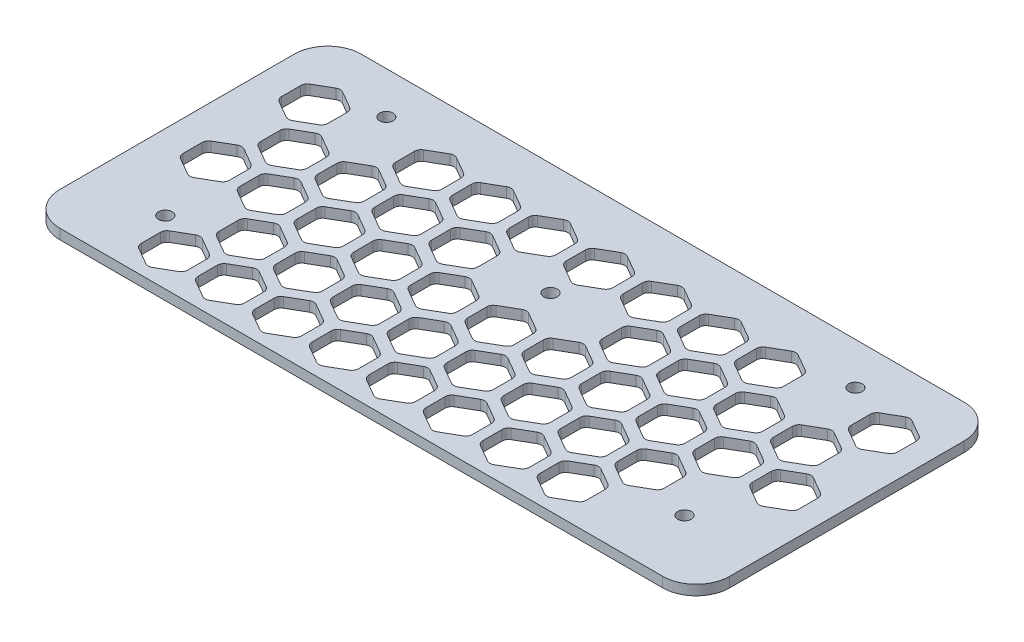
from build123d import *

# Parameters (mm, degrees)
SKETCH_1_W          = 200
SKETCH_1_H          = 90
EXTRUDE_1_DEPTH     = 3
SKETCH_2_R          = 2.025
CUT_EXTRUDE_1_DEPTH = 110.69958979
FILLET_1_R          = 10
FILLET_2_R          = 10
SKETCH_3_R          = 2.025
CUT_EXTRUDE_2_DEPTH = 110.69958979
CUT_EXTRUDE_3_DEPTH = 110.69958979
OTHER_1_DEPTH       = 3
FILLET_3_R          = 2


# Read off the part's stored shape, not the designer's step: 填充阵列1
with BuildPart() as part:
    # 草图1 → 凸台-拉伸1 (new body)
    with BuildSketch(Plane(origin=(0, 0, 0), x_dir=(1, 0, 0), z_dir=(0, 1, 0))):
        Rectangle(SKETCH_1_W, SKETCH_1_H)
    extrude(amount=EXTRUDE_1_DEPTH)

    # 草图2 → 切除-拉伸1 (cut, through all)
    with BuildSketch(Plane(origin=(0, 3, 0), x_dir=(1, 0, 0), z_dir=(0, 1, 0))):
        with Locations(Location((-70, 32.5, 0), (0, 0, 270))):
            Circle(SKETCH_2_R)
        with Locations(Location((70, 32.5, 0), (0, 0, 270))):
            Circle(SKETCH_2_R)
        with Locations(Location((-77.5, -26, 0), (0, 0, 270))):
            Circle(SKETCH_2_R)
        with Locations(Location((77.5, -26, 0), (0, 0, 270))):
            Circle(SKETCH_2_R)
    extrude(amount=-CUT_EXTRUDE_1_DEPTH, mode=Mode.SUBTRACT)

    # 圆角1
    fillet_1_edges = [part.edges().sort_by_distance(p)[0] for p in [
        (-100, 1.5, -45),
        (100, 1.5, -45),
    ]]
    fillet(fillet_1_edges, radius=FILLET_1_R)

    # 圆角2
    fillet_2_edges = [part.edges().sort_by_distance(p)[0] for p in [
        (100, 1.5, 45),
        (-100, 1.5, 45),
    ]]
    fillet(fillet_2_edges, radius=FILLET_2_R)

    # 草图3 → 切除-拉伸2 (cut, through all)
    with BuildSketch(Plane.XZ):
        with Locations(Location((0, -11.5, 0), (0, 0, 270))):
            Circle(SKETCH_3_R)
    extrude(amount=-CUT_EXTRUDE_2_DEPTH, mode=Mode.SUBTRACT)

    # 草图4 → 切除-拉伸3 (cut, through all)
    with BuildSketch(Plane(origin=(0, 3, 0), x_dir=(1, 0, 0), z_dir=(0, 1, 0))):
        Polygon((-84, 17), (-77.07179677, 21), (-77.07179677, 29), (-84, 33), (-90.92820323, 29), (-90.92820323, 21), align=None)
    extrude(amount=-CUT_EXTRUDE_3_DEPTH, mode=Mode.SUBTRACT)

    # 填充阵列1 outline → 填充阵列1 (cut)
    with BuildSketch(Plane(origin=(0, 0, 0), x_dir=(1, 0, 0), z_dir=(0, 1, 0))):
        Polygon((-65.42820323, 14.277568136), (-65.42820323, 6.277568136), (-58.5, 2.277568136), (-51.57179677, 6.277568136), (-51.57179677, 14.277568136), (-58.5, 18.277568136), align=None)
        Polygon((11.07179677, -29.889727457), (11.07179677, -37.889727457), (18, -41.889727457), (24.92820323, -37.889727457), (24.92820323, -29.889727457), (18, -25.889727457), align=None)
        Polygon((-39.92820323, -0.444863729), (-39.92820323, -8.444863729), (-33, -12.444863729), (-26.07179677, -8.444863729), (-26.07179677, -0.444863729), (-33, 3.555136271), align=None)
        Polygon((-14.42820323, -15.167295593), (-14.42820323, -23.167295593), (-7.5, -27.167295593), (-0.57179677, -23.167295593), (-0.57179677, -15.167295593), (-7.5, -11.167295593), align=None)
        Polygon((-84, 3.555136271), (-90.92820323, -0.444863729), (-90.92820323, -8.444863729), (-84, -12.444863729), (-77.07179677, -8.444863729), (-77.07179677, -0.444863729), align=None)
        Polygon((79.07179677, -0.444863729), (79.07179677, -8.444863729), (86, -12.444863729), (92.92820323, -8.444863729), (92.92820323, -0.444863729), (86, 3.555136271), align=None)
        Polygon((28.07179677, 29), (28.07179677, 21), (35, 17), (41.92820323, 21), (41.92820323, 29), (35, 33), align=None)
        Polygon((53.57179677, 14.277568136), (53.57179677, 6.277568136), (60.5, 2.277568136), (67.42820323, 6.277568136), (67.42820323, 14.277568136), (60.5, 18.277568136), align=None)
        Polygon((86, 33), (79.07179677, 29), (79.07179677, 21), (86, 17), (92.92820323, 21), (92.92820323, 29), align=None)
        Polygon((41.92820323, -29.889727457), (35, -25.889727457), (28.07179677, -29.889727457), (28.07179677, -37.889727457), (35, -41.889727457), (41.92820323, -37.889727457), align=None)
        Polygon((67.42820323, -15.167295593), (60.5, -11.167295593), (53.57179677, -15.167295593), (53.57179677, -23.167295593), (60.5, -27.167295593), (67.42820323, -23.167295593), align=None)
        Polygon((-73.92820323, -29.889727457), (-73.92820323, -37.889727457), (-67, -41.889727457), (-60.07179677, -37.889727457), (-60.07179677, -29.889727457), (-67, -25.889727457), align=None)
        Polygon((-67, 3.555136271), (-73.92820323, -0.444863729), (-73.92820323, -8.444863729), (-67, -12.444863729), (-60.07179677, -8.444863729), (-60.07179677, -0.444863729), align=None)
        Polygon((-9.07179677, -0.444863729), (-16, 3.555136271), (-22.92820323, -0.444863729), (-22.92820323, -8.444863729), (-16, -12.444863729), (-9.07179677, -8.444863729), align=None)
        Polygon((-34.57179677, -15.167295593), (-41.5, -11.167295593), (-48.42820323, -15.167295593), (-48.42820323, -23.167295593), (-41.5, -27.167295593), (-34.57179677, -23.167295593), align=None)
        Polygon((-56.92820323, 29), (-56.92820323, 21), (-50, 17), (-43.07179677, 21), (-43.07179677, 29), (-50, 33), align=None)
        Polygon((19.57179677, -15.167295593), (19.57179677, -23.167295593), (26.5, -27.167295593), (33.42820323, -23.167295593), (33.42820323, -15.167295593), (26.5, -11.167295593), align=None)
        Polygon((45.07179677, -29.889727457), (45.07179677, -37.889727457), (52, -41.889727457), (58.92820323, -37.889727457), (58.92820323, -29.889727457), (52, -25.889727457), align=None)
        Polygon((-31.42820323, 14.277568136), (-31.42820323, 6.277568136), (-24.5, 2.277568136), (-17.57179677, 6.277568136), (-17.57179677, 14.277568136), (-24.5, 18.277568136), align=None)
        Polygon((-5.92820323, -0.444863729), (-5.92820323, -8.444863729), (1, -12.444863729), (7.92820323, -8.444863729), (7.92820323, -0.444863729), (1, 3.555136271), align=None)
        Polygon((-50, 3.555136271), (-56.92820323, -0.444863729), (-56.92820323, -8.444863729), (-50, -12.444863729), (-43.07179677, -8.444863729), (-43.07179677, -0.444863729), align=None)
        Polygon((-50, -25.889727457), (-56.92820323, -29.889727457), (-56.92820323, -37.889727457), (-50, -41.889727457), (-43.07179677, -37.889727457), (-43.07179677, -29.889727457), align=None)
        Polygon((-68.57179677, 14.277568136), (-75.5, 18.277568136), (-82.42820323, 14.277568136), (-82.42820323, 6.277568136), (-75.5, 2.277568136), (-68.57179677, 6.277568136), align=None)
        Polygon((-22.92820323, -29.889727457), (-22.92820323, -37.889727457), (-16, -41.889727457), (-9.07179677, -37.889727457), (-9.07179677, -29.889727457), (-16, -25.889727457), align=None)
        Polygon((-34.57179677, 14.277568136), (-41.5, 18.277568136), (-48.42820323, 14.277568136), (-48.42820323, 6.277568136), (-41.5, 2.277568136), (-34.57179677, 6.277568136), align=None)
        Polygon((-9.07179677, 29), (-16, 33), (-22.92820323, 29), (-22.92820323, 21), (-16, 17), (-9.07179677, 21), align=None)
        Polygon((-58.5, -11.167295593), (-65.42820323, -15.167295593), (-65.42820323, -23.167295593), (-58.5, -27.167295593), (-51.57179677, -23.167295593), (-51.57179677, -15.167295593), align=None)
        Polygon((-26.07179677, 29), (-33, 33), (-39.92820323, 29), (-39.92820323, 21), (-33, 17), (-26.07179677, 21), align=None)
        Polygon((2.57179677, -15.167295593), (2.57179677, -23.167295593), (9.5, -27.167295593), (16.42820323, -23.167295593), (16.42820323, -15.167295593), (9.5, -11.167295593), align=None)
        Polygon((36.57179677, -15.167295593), (36.57179677, -23.167295593), (43.5, -27.167295593), (50.42820323, -23.167295593), (50.42820323, -15.167295593), (43.5, -11.167295593), align=None)
        Polygon((11.07179677, -0.444863729), (11.07179677, -8.444863729), (18, -12.444863729), (24.92820323, -8.444863729), (24.92820323, -0.444863729), (18, 3.555136271), align=None)
        Polygon((-33, -25.889727457), (-39.92820323, -29.889727457), (-39.92820323, -37.889727457), (-33, -41.889727457), (-26.07179677, -37.889727457), (-26.07179677, -29.889727457), align=None)
        Polygon((24.92820323, 29), (18, 33), (11.07179677, 29), (11.07179677, 21), (18, 17), (24.92820323, 21), align=None)
        Polygon((-31.42820323, -15.167295593), (-31.42820323, -23.167295593), (-24.5, -27.167295593), (-17.57179677, -23.167295593), (-17.57179677, -15.167295593), (-24.5, -11.167295593), align=None)
        Polygon((-5.92820323, -29.889727457), (-5.92820323, -37.889727457), (1, -41.889727457), (7.92820323, -37.889727457), (7.92820323, -29.889727457), (1, -25.889727457), align=None)
        Polygon((7.92820323, 29), (1, 33), (-5.92820323, 29), (-5.92820323, 21), (1, 17), (7.92820323, 21), align=None)
        Polygon((36.57179677, 14.277568136), (36.57179677, 6.277568136), (43.5, 2.277568136), (50.42820323, 6.277568136), (50.42820323, 14.277568136), (43.5, 18.277568136), align=None)
        Polygon((62.07179677, -0.444863729), (62.07179677, -8.444863729), (69, -12.444863729), (75.92820323, -8.444863729), (75.92820323, -0.444863729), (69, 3.555136271), align=None)
        Polygon((28.07179677, -0.444863729), (28.07179677, -8.444863729), (35, -12.444863729), (41.92820323, -8.444863729), (41.92820323, -0.444863729), (35, 3.555136271), align=None)
        Polygon((45.07179677, 29), (45.07179677, 21), (52, 17), (58.92820323, 21), (58.92820323, 29), (52, 33), align=None)
        Polygon((70.57179677, 14.277568136), (70.57179677, 6.277568136), (77.5, 2.277568136), (84.42820323, 6.277568136), (84.42820323, 14.277568136), (77.5, 18.277568136), align=None)
        Polygon((52, 3.555136271), (45.07179677, -0.444863729), (45.07179677, -8.444863729), (52, -12.444863729), (58.92820323, -8.444863729), (58.92820323, -0.444863729), align=None)
        Polygon((33.42820323, 14.277568136), (26.5, 18.277568136), (19.57179677, 14.277568136), (19.57179677, 6.277568136), (26.5, 2.277568136), (33.42820323, 6.277568136), align=None)
    extrude(amount=OTHER_1_DEPTH, mode=Mode.SUBTRACT)

    # 圆角3
    fillet_3_edges = [part.edges().sort_by_distance(p)[0] for p in [
        (-7.5, 1.5, 27.167295593),
        (-14.42820323, 1.5, 23.167295593),
        (-14.42820323, 1.5, 15.167295593),
        (-7.5, 1.5, 11.167295593),
        (-0.57179677, 1.5, 15.167295593),
        (-0.57179677, 1.5, 23.167295593),
        (1, 1.5, 12.444863729),
        (-5.92820323, 1.5, 8.444863729),
        (-5.92820323, 1.5, 0.444863729),
        (1, 1.5, -3.555136271),
        (7.92820323, 1.5, 0.444863729),
        (7.92820323, 1.5, 8.444863729),
        (-16, 1.5, 41.889727457),
        (-22.92820323, 1.5, 37.889727457),
        (-22.92820323, 1.5, 29.889727457),
        (-16, 1.5, 25.889727457),
        (-9.07179677, 1.5, 29.889727457),
        (-9.07179677, 1.5, 37.889727457),
        (1, 1.5, -17),
        (-5.92820323, 1.5, -21),
        (-5.92820323, 1.5, -29),
        (1, 1.5, -33),
        (7.92820323, 1.5, -29),
        (7.92820323, 1.5, -21),
        (9.5, 1.5, 27.167295593),
        (2.57179677, 1.5, 23.167295593),
        (2.57179677, 1.5, 15.167295593),
        (9.5, 1.5, 11.167295593),
        (16.42820323, 1.5, 15.167295593),
        (16.42820323, 1.5, 23.167295593),
        (18, 1.5, 12.444863729),
        (11.07179677, 1.5, 8.444863729),
        (11.07179677, 1.5, 0.444863729),
        (18, 1.5, -3.555136271),
        (24.92820323, 1.5, 0.444863729),
        (24.92820323, 1.5, 8.444863729),
        (1, 1.5, 41.889727457),
        (-5.92820323, 1.5, 37.889727457),
        (-5.92820323, 1.5, 29.889727457),
        (1, 1.5, 25.889727457),
        (7.92820323, 1.5, 29.889727457),
        (7.92820323, 1.5, 37.889727457),
        (18, 1.5, -17),
        (11.07179677, 1.5, -21),
        (11.07179677, 1.5, -29),
        (18, 1.5, -33),
        (24.92820323, 1.5, -29),
        (24.92820323, 1.5, -21),
        (-33, 1.5, 12.444863729),
        (-39.92820323, 1.5, 8.444863729),
        (-39.92820323, 1.5, 0.444863729),
        (-33, 1.5, -3.555136271),
        (-26.07179677, 1.5, 0.444863729),
        (-26.07179677, 1.5, 8.444863729),
        (-24.5, 1.5, -2.277568136),
        (-31.42820323, 1.5, -6.277568136),
        (-31.42820323, 1.5, -14.277568136),
        (-24.5, 1.5, -18.277568136),
        (-17.57179677, 1.5, -14.277568136),
        (-17.57179677, 1.5, -6.277568136),
        (-50, 1.5, 41.889727457),
        (-56.92820323, 1.5, 37.889727457),
        (-56.92820323, 1.5, 29.889727457),
        (-50, 1.5, 25.889727457),
        (-43.07179677, 1.5, 29.889727457),
        (-43.07179677, 1.5, 37.889727457),
        (-41.5, 1.5, 27.167295593),
        (-48.42820323, 1.5, 23.167295593),
        (-48.42820323, 1.5, 15.167295593),
        (-41.5, 1.5, 11.167295593),
        (-34.57179677, 1.5, 15.167295593),
        (-34.57179677, 1.5, 23.167295593),
        (-24.5, 1.5, 27.167295593),
        (-31.42820323, 1.5, 23.167295593),
        (-31.42820323, 1.5, 15.167295593),
        (-24.5, 1.5, 11.167295593),
        (-17.57179677, 1.5, 15.167295593),
        (-17.57179677, 1.5, 23.167295593),
        (-16, 1.5, 12.444863729),
        (-22.92820323, 1.5, 8.444863729),
        (-22.92820323, 1.5, 0.444863729),
        (-16, 1.5, -3.555136271),
        (-9.07179677, 1.5, 0.444863729),
        (-9.07179677, 1.5, 8.444863729),
        (-33, 1.5, 41.889727457),
        (-39.92820323, 1.5, 37.889727457),
        (-39.92820323, 1.5, 29.889727457),
        (-33, 1.5, 25.889727457),
        (-26.07179677, 1.5, 29.889727457),
        (-26.07179677, 1.5, 37.889727457),
        (-16, 1.5, -17),
        (-22.92820323, 1.5, -21),
        (-22.92820323, 1.5, -29),
        (-16, 1.5, -33),
        (-9.07179677, 1.5, -29),
        (-9.07179677, 1.5, -21),
        (52, 1.5, 41.889727457),
        (45.07179677, 1.5, 37.889727457),
        (45.07179677, 1.5, 29.889727457),
        (52, 1.5, 25.889727457),
        (58.92820323, 1.5, 29.889727457),
        (58.92820323, 1.5, 37.889727457),
        (60.5, 1.5, -2.277568136),
        (53.57179677, 1.5, -6.277568136),
        (53.57179677, 1.5, -14.277568136),
        (60.5, 1.5, -18.277568136),
        (67.42820323, 1.5, -14.277568136),
        (67.42820323, 1.5, -6.277568136),
        (43.5, 1.5, 27.167295593),
        (36.57179677, 1.5, 23.167295593),
        (36.57179677, 1.5, 15.167295593),
        (43.5, 1.5, 11.167295593),
        (50.42820323, 1.5, 15.167295593),
        (50.42820323, 1.5, 23.167295593),
        (52, 1.5, 12.444863729),
        (45.07179677, 1.5, 8.444863729),
        (45.07179677, 1.5, 0.444863729),
        (52, 1.5, -3.555136271),
        (58.92820323, 1.5, 0.444863729),
        (58.92820323, 1.5, 8.444863729),
        (77.5, 1.5, -2.277568136),
        (70.57179677, 1.5, -6.277568136),
        (70.57179677, 1.5, -14.277568136),
        (77.5, 1.5, -18.277568136),
        (84.42820323, 1.5, -14.277568136),
        (84.42820323, 1.5, -6.277568136),
        (86, 1.5, -17),
        (79.07179677, 1.5, -21),
        (79.07179677, 1.5, -29),
        (86, 1.5, -33),
        (92.92820323, 1.5, -29),
        (92.92820323, 1.5, -21),
        (60.5, 1.5, 27.167295593),
        (53.57179677, 1.5, 23.167295593),
        (53.57179677, 1.5, 15.167295593),
        (60.5, 1.5, 11.167295593),
        (67.42820323, 1.5, 15.167295593),
        (67.42820323, 1.5, 23.167295593),
        (69, 1.5, 12.444863729),
        (62.07179677, 1.5, 8.444863729),
        (62.07179677, 1.5, 0.444863729),
        (69, 1.5, -3.555136271),
        (75.92820323, 1.5, 0.444863729),
        (75.92820323, 1.5, 8.444863729),
        (35, 1.5, -17),
        (28.07179677, 1.5, -21),
        (28.07179677, 1.5, -29),
        (35, 1.5, -33),
        (41.92820323, 1.5, -29),
        (41.92820323, 1.5, -21),
        (26.5, 1.5, -2.277568136),
        (19.57179677, 1.5, -6.277568136),
        (19.57179677, 1.5, -14.277568136),
        (26.5, 1.5, -18.277568136),
        (33.42820323, 1.5, -14.277568136),
        (33.42820323, 1.5, -6.277568136),
        (26.5, 1.5, 27.167295593),
        (19.57179677, 1.5, 23.167295593),
        (19.57179677, 1.5, 15.167295593),
        (26.5, 1.5, 11.167295593),
        (33.42820323, 1.5, 15.167295593),
        (33.42820323, 1.5, 23.167295593),
        (18, 1.5, 41.889727457),
        (11.07179677, 1.5, 37.889727457),
        (11.07179677, 1.5, 29.889727457),
        (18, 1.5, 25.889727457),
        (24.92820323, 1.5, 29.889727457),
        (24.92820323, 1.5, 37.889727457),
        (35, 1.5, 41.889727457),
        (28.07179677, 1.5, 37.889727457),
        (28.07179677, 1.5, 29.889727457),
        (35, 1.5, 25.889727457),
        (41.92820323, 1.5, 29.889727457),
        (41.92820323, 1.5, 37.889727457),
        (52, 1.5, -17),
        (45.07179677, 1.5, -21),
        (45.07179677, 1.5, -29),
        (52, 1.5, -33),
        (58.92820323, 1.5, -29),
        (58.92820323, 1.5, -21),
        (35, 1.5, 12.444863729),
        (28.07179677, 1.5, 8.444863729),
        (28.07179677, 1.5, 0.444863729),
        (35, 1.5, -3.555136271),
        (41.92820323, 1.5, 0.444863729),
        (41.92820323, 1.5, 8.444863729),
        (43.5, 1.5, -2.277568136),
        (36.57179677, 1.5, -6.277568136),
        (36.57179677, 1.5, -14.277568136),
        (43.5, 1.5, -18.277568136),
        (50.42820323, 1.5, -14.277568136),
        (50.42820323, 1.5, -6.277568136),
        (-75.5, 1.5, -2.277568136),
        (-82.42820323, 1.5, -6.277568136),
        (-82.42820323, 1.5, -14.277568136),
        (-75.5, 1.5, -18.277568136),
        (-68.57179677, 1.5, -14.277568136),
        (-68.57179677, 1.5, -6.277568136),
        (-84, 1.5, 12.444863729),
        (-90.92820323, 1.5, 8.444863729),
        (-90.92820323, 1.5, 0.444863729),
        (-84, 1.5, -3.555136271),
        (-77.07179677, 1.5, 0.444863729),
        (-77.07179677, 1.5, 8.444863729),
        (-50, 1.5, 12.444863729),
        (-56.92820323, 1.5, 8.444863729),
        (-56.92820323, 1.5, 0.444863729),
        (-50, 1.5, -3.555136271),
        (-43.07179677, 1.5, 0.444863729),
        (-43.07179677, 1.5, 8.444863729),
        (-58.5, 1.5, 27.167295593),
        (-65.42820323, 1.5, 23.167295593),
        (-65.42820323, 1.5, 15.167295593),
        (-58.5, 1.5, 11.167295593),
        (-51.57179677, 1.5, 15.167295593),
        (-51.57179677, 1.5, 23.167295593),
        (-33, 1.5, -17),
        (-39.92820323, 1.5, -21),
        (-39.92820323, 1.5, -29),
        (-33, 1.5, -33),
        (-26.07179677, 1.5, -29),
        (-26.07179677, 1.5, -21),
        (-84, 1.5, -17),
        (-41.5, 1.5, -2.277568136),
        (-48.42820323, 1.5, -6.277568136),
        (-90.92820323, 1.5, -21),
        (-48.42820323, 1.5, -14.277568136),
        (-41.5, 1.5, -18.277568136),
        (-34.57179677, 1.5, -14.277568136),
        (-34.57179677, 1.5, -6.277568136),
        (-90.92820323, 1.5, -29),
        (-84, 1.5, -33),
        (-58.5, 1.5, -2.277568136),
        (-65.42820323, 1.5, -6.277568136),
        (-65.42820323, 1.5, -14.277568136),
        (-58.5, 1.5, -18.277568136),
        (-51.57179677, 1.5, -14.277568136),
        (-51.57179677, 1.5, -6.277568136),
        (-77.07179677, 1.5, -29),
        (-77.07179677, 1.5, -21),
        (-67, 1.5, 12.444863729),
        (-73.92820323, 1.5, 8.444863729),
        (-73.92820323, 1.5, 0.444863729),
        (-67, 1.5, -3.555136271),
        (-60.07179677, 1.5, 0.444863729),
        (-60.07179677, 1.5, 8.444863729),
        (-50, 1.5, -17),
        (-56.92820323, 1.5, -21),
        (-56.92820323, 1.5, -29),
        (-50, 1.5, -33),
        (-43.07179677, 1.5, -29),
        (-43.07179677, 1.5, -21),
        (-67, 1.5, 41.889727457),
        (-73.92820323, 1.5, 37.889727457),
        (-73.92820323, 1.5, 29.889727457),
        (-67, 1.5, 25.889727457),
        (-60.07179677, 1.5, 29.889727457),
        (-60.07179677, 1.5, 37.889727457),
        (86, 1.5, 12.444863729),
        (79.07179677, 1.5, 8.444863729),
        (79.07179677, 1.5, 0.444863729),
        (86, 1.5, -3.555136271),
        (92.92820323, 1.5, 0.444863729),
        (92.92820323, 1.5, 8.444863729),
    ]]
    fillet(fillet_3_edges, radius=FILLET_3_R)


solid = part.part
